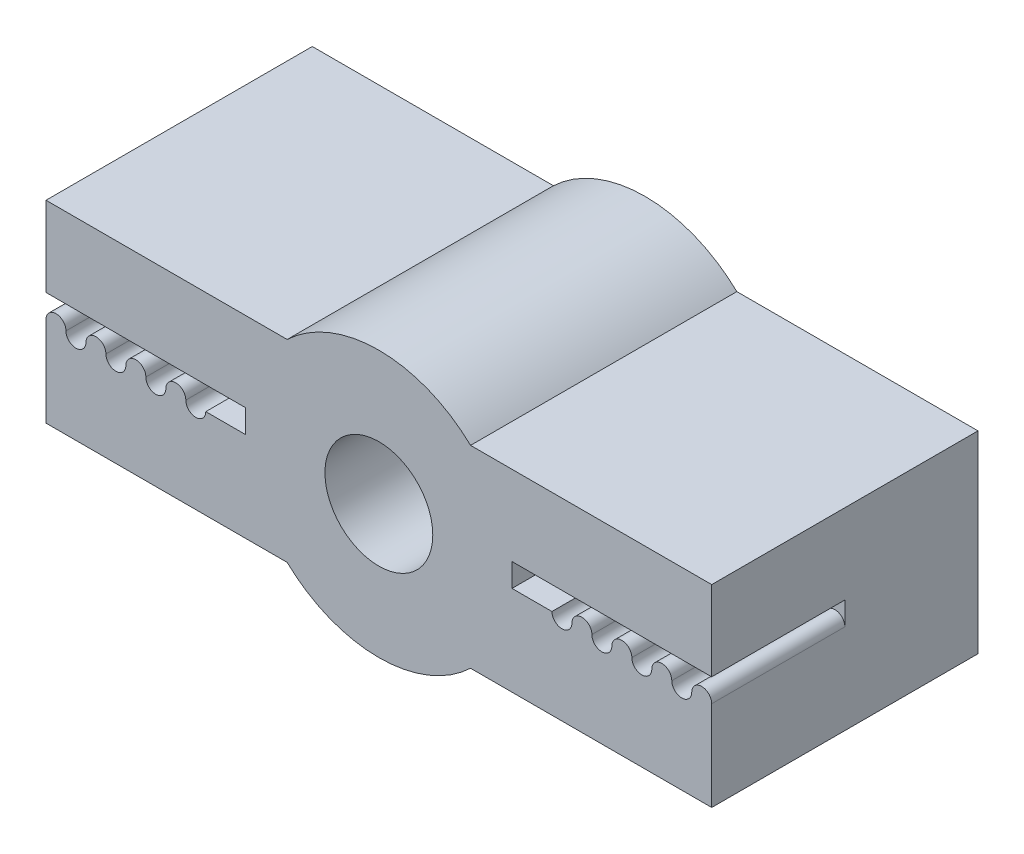
from build123d import *

# Parameters (mm, degrees)
EXTRUDE_1_DEPTH     = 20
OTHER_START         = 15
OTHER_1_OUTLINE_R   = 4.05
OTHER_1_DEPTH       = 20
CUT_EXTRUDE_1_DEPTH = 10


# Read off the part's stored shape, not the designer's step: 高级异型孔1
with BuildPart() as part:
    # 草图3 → 凸台-拉伸1 (new body)
    with BuildSketch(Plane.XY.offset(15)):
        with BuildLine():
            Line((26.887488657, 8.75), (45, 8.75))
            Line((45, 8.75), (45, 23.25))
            Line((45, 23.25), (26.887488657, 23.25))
            ThreePointArc((26.887488657, 23.25), (20, 26), (13.112511343, 23.25))
            Line((13.112511343, 23.25), (-5, 23.25))
            Line((-5, 23.25), (-5, 8.75))
            Line((-5, 8.75), (13.112511343, 8.75))
            ThreePointArc((13.112511343, 8.75), (20, 6), (26.887488657, 8.75))
        make_face()
    extrude(amount=EXTRUDE_1_DEPTH)

    # 高级异型孔1 outline → 高级异型孔1 (cut)
    with BuildSketch(Plane.XY.offset(OTHER_START)):
        with Locations((20, 16)):
            Circle(OTHER_1_OUTLINE_R)
    extrude(amount=OTHER_1_DEPTH, mode=Mode.SUBTRACT)

    # 草图6 → 切除-拉伸1 (cut)
    with BuildSketch(Plane.XY.offset(35)):
        with BuildLine():
            Line((-5, 15.5), (-5, 17.25))
            Line((-5, 17.25), (10, 17.25))
            Line((10, 17.25), (10, 15.5))
            Line((10, 15.5), (7, 15.5))
            ThreePointArc((7, 15.5), (6.25, 14.75), (5.5, 15.5))
            ThreePointArc((5.5, 15.5), (4.75, 16.25), (4, 15.5))
            ThreePointArc((4, 15.5), (3.25, 14.75), (2.5, 15.5))
            ThreePointArc((2.5, 15.5), (1.75, 16.25), (1, 15.5))
            ThreePointArc((1, 15.5), (0.25, 14.75), (-0.5, 15.5))
            ThreePointArc((-0.5, 15.5), (-1.25, 16.25), (-2, 15.5))
            ThreePointArc((-2, 15.5), (-2.75, 14.75), (-3.5, 15.5))
            ThreePointArc((-3.5, 15.5), (-4.25, 16.25), (-5, 15.5))
        make_face()
        with BuildLine():
            Line((45, 17.25), (30, 17.25))
            Line((30, 17.25), (30, 15.5))
            Line((30, 15.5), (33, 15.5))
            ThreePointArc((33, 15.5), (33.75, 14.75), (34.5, 15.5))
            ThreePointArc((34.5, 15.5), (35.25, 16.25), (36, 15.5))
            ThreePointArc((36, 15.5), (36.75, 14.75), (37.5, 15.5))
            ThreePointArc((37.5, 15.5), (38.25, 16.25), (39, 15.5))
            ThreePointArc((39, 15.5), (39.75, 14.75), (40.5, 15.5))
            ThreePointArc((40.5, 15.5), (41.25, 16.25), (42, 15.5))
            ThreePointArc((42, 15.5), (42.75, 14.75), (43.5, 15.5))
            ThreePointArc((43.5, 15.5), (44.25, 16.25), (45, 15.5))
            Line((45, 15.5), (45, 17.25))
        make_face()
    extrude(amount=-CUT_EXTRUDE_1_DEPTH, mode=Mode.SUBTRACT)


solid = part.part
